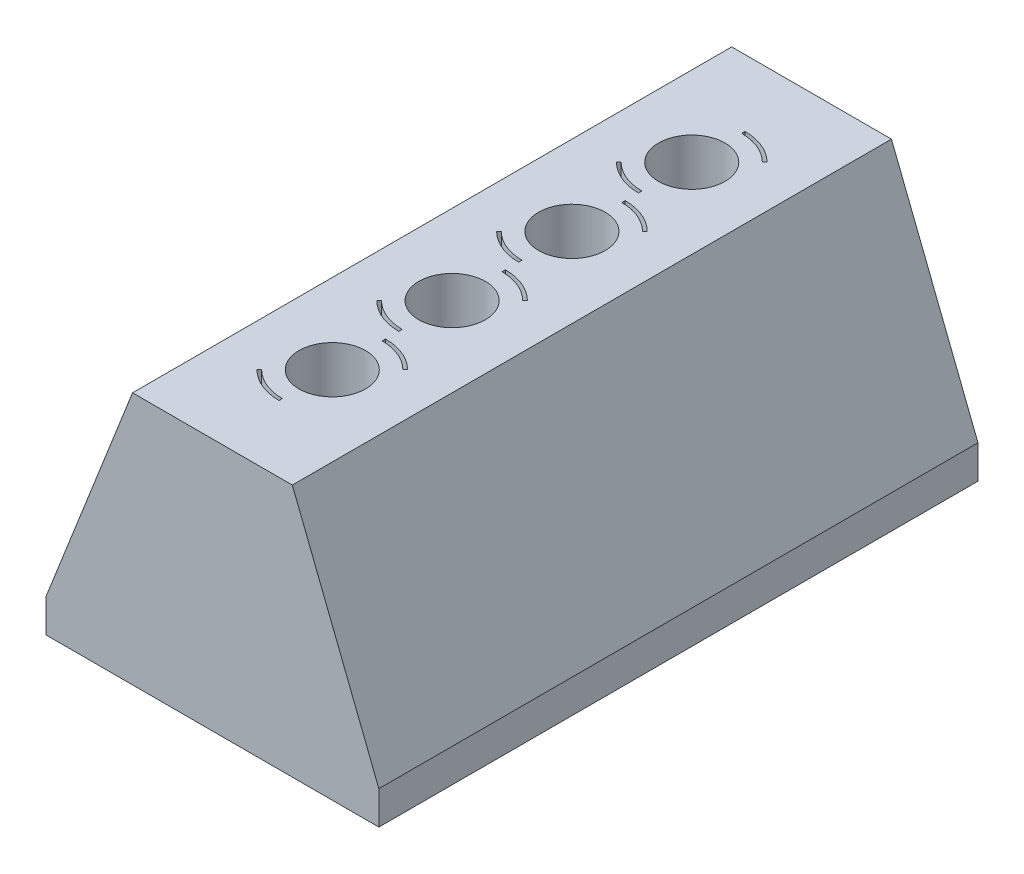
from build123d import *

# Parameters (mm, degrees)
ESTRUSIONE_ESTRUSIONE1_DEPTH = 225
SCHIZZO2_R                   = 25
TAGLIO_ESTRUSIONE1_DEPTH     = 90
SVUOTA1_T                    = -15
TAGLIO_ESTRUSIONE2_START     = -20
SCHIZZO4_R                   = 40
TAGLIO_ESTRUSIONE2_DEPTH     = 20
ESTRUSIONE_ESTRUSIONE2_START = 10
SCHIZZO6_W                   = 154.725791786
SCHIZZO6_H                   = 435
SCHIZZO6_R                   = 40
ESTRUSIONE_ESTRUSIONE2_DEPTH = 10
ESTRUSIONE_ESTRUSIONE3_DEPTH = 15
SCHIZZO12_R                  = 35
TAGLIO_ESTRUSIONE12_DEPTH    = 491.866580651
TAGLIO_ESTRUSIONE13_DEPTH    = 20


with BuildPart() as part:
    # Schizzo1 → Estrusione-Estrusione1 (new, symmetric)
    with BuildSketch(Plane.XY):
        Polygon((-125, 0), (125, 0), (125, 25), (60, 190), (-60, 190), (-125, 25), align=None)
    extrude(amount=ESTRUSIONE_ESTRUSIONE1_DEPTH, both=True)

    # Schizzo2 → Taglio-Estrusione1 (cut)
    with BuildSketch(Plane(origin=(0, 190, 0), x_dir=(1, 0, 0), z_dir=(0, 1, 0))):
        with Locations((0, -135)):
            Circle(SCHIZZO2_R)
        with Locations((0, 135)):
            Circle(SCHIZZO2_R)
        with Locations((0, 45)):
            Circle(SCHIZZO2_R)
        with Locations((0, -45)):
            Circle(SCHIZZO2_R)
    extrude(amount=-TAGLIO_ESTRUSIONE1_DEPTH, mode=Mode.SUBTRACT)

    # Svuota1
    svuota1_openings = [part.faces().sort_by_distance(p)[0] for p in [
        (0, 83.334466349, 225),
    ]]
    offset(amount=SVUOTA1_T, openings=svuota1_openings, kind=Kind.INTERSECTION)

    # Schizzo4 → Taglio-Estrusione2 (cut)
    with BuildSketch(Plane.XZ.offset(-85).offset(TAGLIO_ESTRUSIONE2_START)):
        with Locations((0, -135)):
            Circle(SCHIZZO4_R)
        with Locations((0, -45)):
            Circle(SCHIZZO4_R)
        with Locations((0, 45)):
            Circle(SCHIZZO4_R)
        with Locations((0, 135)):
            Circle(SCHIZZO4_R)
    extrude(amount=TAGLIO_ESTRUSIONE2_DEPTH, mode=Mode.SUBTRACT)

    # Schizzo6 → Estrusione-Estrusione2 (add)
    with BuildSketch(Plane(origin=(0, 105, 0), x_dir=(1, 0, 0), z_dir=(0, 1, 0)).offset(ESTRUSIONE_ESTRUSIONE2_START)):
        with Locations((0, -7.5)):
            Rectangle(SCHIZZO6_W, SCHIZZO6_H)
        with Locations((0, 135)):
            Circle(SCHIZZO6_R, mode=Mode.SUBTRACT)
        with Locations((0, 45)):
            Circle(SCHIZZO6_R, mode=Mode.SUBTRACT)
        with Locations((0, -45)):
            Circle(SCHIZZO6_R, mode=Mode.SUBTRACT)
        with Locations((0, -135)):
            Circle(SCHIZZO6_R, mode=Mode.SUBTRACT)
    extrude(amount=-ESTRUSIONE_ESTRUSIONE2_DEPTH)

    # Schizzo7 → Estrusione-Estrusione3 (add)
    with BuildSketch(Plane.XY.offset(225)):
        Polygon((-125, 25), (-125, 0), (125, 0), (125, 25), (60, 190), (-60, 190), align=None)
    extrude(amount=-ESTRUSIONE_ESTRUSIONE3_DEPTH)

    # Schizzo12 → Taglio-Estrusione12 (cut, through all)
    with BuildSketch(Plane.XY.offset(-210)):
        with Locations((0, 60)):
            Circle(SCHIZZO12_R)
    extrude(amount=-TAGLIO_ESTRUSIONE12_DEPTH, mode=Mode.SUBTRACT)

    # Schizzo13 → Taglio-Estrusione13 (cut)
    with BuildSketch(Plane(origin=(0, 190, 0), x_dir=(1, 0, 0), z_dir=(0, 1, 0))):
        with BuildLine():
            Line((0, 97.5), (0, 95))
            ThreePointArc((0, 95), (-15.307337295, 98.0448187), (-28.284271247, 106.715728753))
            Line((-28.284271247, 106.715728753), (-26.516504294, 108.483495706))
            ThreePointArc((-26.516504294, 108.483495706), (-14.350628714, 100.354517531), (0, 97.5))
        make_face()
        with BuildLine():
            Line((26.516504294, 161.516504294), (28.284271247, 163.284271247))
            ThreePointArc((28.284271247, 163.284271247), (15.307337295, 171.9551813), (0, 175))
            Line((0, 175), (0, 172.5))
            ThreePointArc((0, 172.5), (14.350628714, 169.645482469), (26.516504294, 161.516504294))
        make_face()
        with BuildLine():
            Line((-26.516504294, 18.483495706), (-28.284271247, 16.715728753))
            ThreePointArc((-28.284271247, 16.715728753), (-15.307337295, 8.0448187), (0, 5))
            Line((0, 5), (0, 7.5))
            ThreePointArc((0, 7.5), (-14.350628714, 10.354517531), (-26.516504294, 18.483495706))
        make_face()
        with BuildLine():
            Line((26.516504294, 71.516504294), (28.284271247, 73.284271247))
            ThreePointArc((28.284271247, 73.284271247), (15.307337295, 81.9551813), (0, 85))
            Line((0, 85), (0, 82.5))
            ThreePointArc((0, 82.5), (14.350628714, 79.645482469), (26.516504294, 71.516504294))
        make_face()
        with BuildLine():
            Line((-26.516504294, -71.516504294), (-28.284271247, -73.284271247))
            ThreePointArc((-28.284271247, -73.284271247), (-15.307337295, -81.9551813), (0, -85))
            Line((0, -85), (0, -82.5))
            ThreePointArc((0, -82.5), (-14.350628714, -79.645482469), (-26.516504294, -71.516504294))
        make_face()
        with BuildLine():
            Line((26.516504294, -18.483495706), (28.284271247, -16.715728753))
            ThreePointArc((28.284271247, -16.715728753), (15.307337295, -8.0448187), (0, -5))
            Line((0, -5), (0, -7.5))
            ThreePointArc((0, -7.5), (14.350628714, -10.354517531), (26.516504294, -18.483495706))
        make_face()
        with BuildLine():
            Line((-26.516504294, -161.516504294), (-28.284271247, -163.284271247))
            ThreePointArc((-28.284271247, -163.284271247), (-15.307337295, -171.9551813), (0, -175))
            Line((0, -175), (0, -172.5))
            ThreePointArc((0, -172.5), (-14.350628714, -169.645482469), (-26.516504294, -161.516504294))
        make_face()
        with BuildLine():
            Line((26.516504294, -108.483495706), (28.284271247, -106.715728753))
            ThreePointArc((28.284271247, -106.715728753), (15.307337295, -98.0448187), (0, -95))
            Line((0, -95), (0, -97.5))
            ThreePointArc((0, -97.5), (14.350628714, -100.354517531), (26.516504294, -108.483495706))
        make_face()
    extrude(amount=-TAGLIO_ESTRUSIONE13_DEPTH, mode=Mode.SUBTRACT)


solid = part.part
